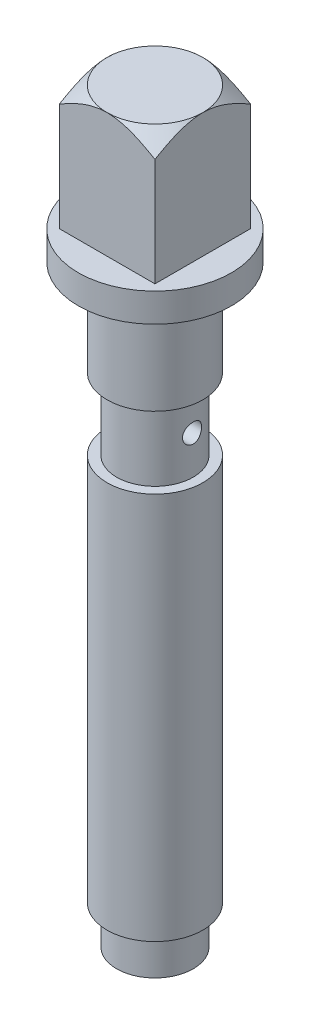
from build123d import *

# Parameters (mm, degrees)
SKETCH2_R               = 4
BOSS_EXTRUDE1_DEPTH     = 4
SKETCH3_R               = 5
BOSS_EXTRUDE2_DEPTH     = 40.5
SKETCH4_R               = 4
BOSS_EXTRUDE3_DEPTH     = 7.5
CUT_EXTRUDE1_DEPTH      = 7.5
CUT_EXTRUDE1_DEPTH_BACK = 7.5
SKETCH5_R               = 1
SKETCH6_R               = 5
BOSS_EXTRUDE4_DEPTH     = 10
SKETCH7_R               = 8
BOSS_EXTRUDE5_DEPTH     = 3
SKETCH8_W               = 10
SKETCH8_H               = 10
BOSS_EXTRUDE6_DEPTH     = 13
SKETCH9_OUTSIDE_W       = 39.01
SKETCH9_OUTSIDE_H       = 39.01
SKETCH9_OUTSIDE_R       = 5
CUT_EXTRUDE3_DEPTH      = 2
CUT_EXTRUDE3_DRAFT      = -50


with BuildPart() as part:
    # Sketch2 → Boss-Extrude1 (new body)
    with BuildSketch(Plane(origin=(0, 0, 0), x_dir=(1, 0, 0), z_dir=(0, 1, 0))):
        Circle(SKETCH2_R)
    extrude(amount=BOSS_EXTRUDE1_DEPTH)

    # Sketch3 → Boss-Extrude2 (add)
    with BuildSketch(Plane(origin=(0, 4, 0), x_dir=(1, 0, 0), z_dir=(0, 1, 0))):
        Circle(SKETCH3_R)
    extrude(amount=BOSS_EXTRUDE2_DEPTH)

    # Sketch4 → Boss-Extrude3 (add)
    with BuildSketch(Plane(origin=(0, 44.5, 0), x_dir=(1, 0, 0), z_dir=(0, 1, 0))):
        Circle(SKETCH4_R)
    extrude(amount=BOSS_EXTRUDE3_DEPTH)

    # Sketch5 → Cut-Extrude1 (cut, two sides: drawn at the far end of the back side and taken through both)
    with BuildSketch(Plane(origin=(0, 0, 0), x_dir=(0, 0, -1), z_dir=(1, 0, 0)).offset(-CUT_EXTRUDE1_DEPTH_BACK)):
        with Locations((0, 48.5)):
            Circle(SKETCH5_R)
    extrude(amount=CUT_EXTRUDE1_DEPTH + CUT_EXTRUDE1_DEPTH_BACK, mode=Mode.SUBTRACT)

    # Sketch6 → Boss-Extrude4 (add)
    with BuildSketch(Plane(origin=(0, 52, 0), x_dir=(1, 0, 0), z_dir=(0, 1, 0))):
        Circle(SKETCH6_R)
    extrude(amount=BOSS_EXTRUDE4_DEPTH)

    # Sketch7 → Boss-Extrude5 (add)
    with BuildSketch(Plane(origin=(0, 62, 0), x_dir=(1, 0, 0), z_dir=(0, 1, 0))):
        Circle(SKETCH7_R)
    extrude(amount=BOSS_EXTRUDE5_DEPTH)

    # Sketch8 → Boss-Extrude6 (add)
    with BuildSketch(Plane(origin=(0, 65, 0), x_dir=(1, 0, 0), z_dir=(0, 1, 0))):
        Rectangle(SKETCH8_W, SKETCH8_H)
    extrude(amount=BOSS_EXTRUDE6_DEPTH)


with BuildPart() as cut_extrude3_tool:
    # Sketch9 outside → Cut-Extrude3 (with draft: the straight prism first)
    with BuildSketch(Plane(origin=(0, 78, 0), x_dir=(1, 0, 0), z_dir=(0, 1, 0))):
        Rectangle(SKETCH9_OUTSIDE_W, SKETCH9_OUTSIDE_H)
        Circle(SKETCH9_OUTSIDE_R, mode=Mode.SUBTRACT)
    extrude(amount=-CUT_EXTRUDE3_DEPTH)
    # Cut-Extrude3: the draft: its side faces are tilted about the plane it starts from
    cut_extrude3_sides = [cut_extrude3_tool.faces().sort_by_distance(p)[0] for p in [
        (0, 77, 19.505),
        (19.505, 77, 0),
        (0, 77, -19.505),
        (-19.505, 77, 0),
        (-5, 77, 0),
    ]]
    draft(cut_extrude3_sides, Plane(origin=(0, 78, 0), x_dir=(1, 0, 0), z_dir=(0, 1, 0)), CUT_EXTRUDE3_DRAFT)


with BuildPart() as part_1:
    add(part.part)

    # Cut-Extrude3: cut by cut_extrude3_tool
    add(cut_extrude3_tool.part, mode=Mode.SUBTRACT)


solid = part_1.part
